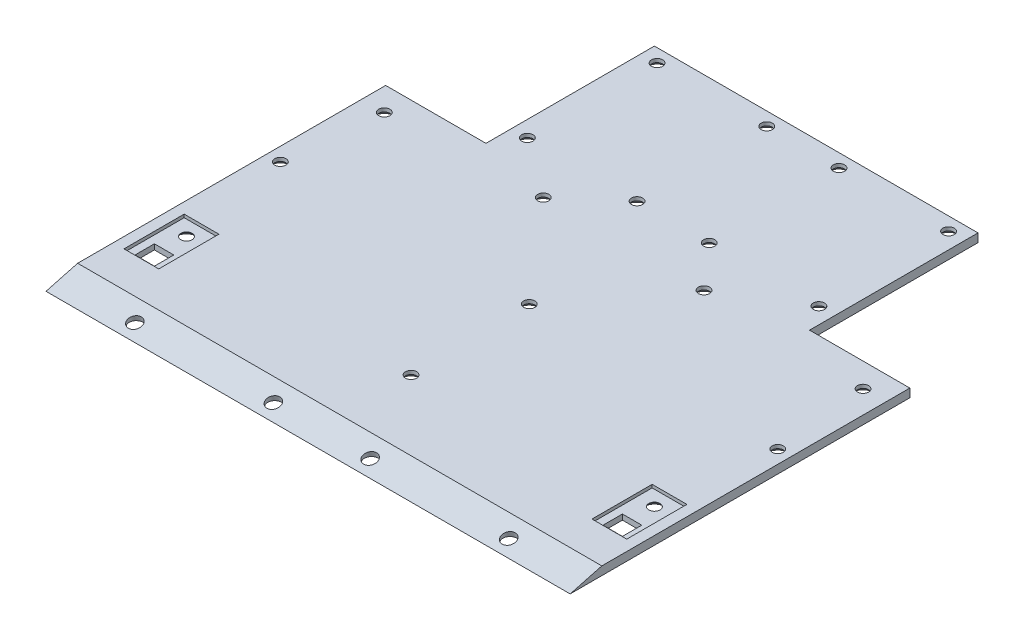
from build123d import *

# Parameters (mm, degrees)
SALIENTE_EXTRUIR1_DEPTH                              = 196
CORTAR_EXTRUIR1_REACH                                = 274.995
CROQUIS2_W                                           = 37.5
CROQUIS2_H                                           = 62.989872981
CROQUIS3_W                                           = 13
CROQUIS3_H                                           = 22.5
CORTAR_EXTRUIR2_DEPTH                                = 1.17
CORTAR_EXTRUIR3_REACH                                = 274.984
CROQUIS5_W                                           = 7.25
CROQUIS5_H                                           = 7.25
CORTAR_EXTRUIR4_REACH                                = 274.984
CROQUIS6_R                                           = 1.6
CUT_EXTRUDE1_REACH                                   = 274.995
SKETCH1_R                                            = 1.585
CUT_EXTRUDE2_REACH                                   = 274.995
SKETCH2_R                                            = 1.585
CUT_EXTRUDE3_REACH                                   = 274.995
SKETCH3_R                                            = 1.579889923
SKETCH3_R_2                                          = 1.585
SKETCH4_R                                            = 1.6
CUT_EXTRUDE4_DEPTH                                   = 4.9
AVELLANADO_PARA_TORNILLO_CON_CABEZA_AVEL_D           = 4.2
AVELLANADO_PARA_TORNILLO_CON_CABEZA_AVEL_DEPTH       = 10
AVELLANADO_PARA_TORNILLO_CON_CABEZA_AVEL_CSINK_D     = 8
AVELLANADO_PARA_TORNILLO_CON_CABEZA_AVEL_CSINK_ANGLE = 92
AVELLANADO_PARA_TORNILLO_CON_CABEZA_AVEL_TIP         = 1.2618073
SKETCH6_R                                            = 1.585
CUT_EXTRUDE5_DEPTH                                   = 10
SKETCH8_R                                            = 2.5
CUT_EXTRUDE6_DEPTH                                   = 10
AVELLANADO_PARA_TORNILLO_CON_CABEZA_2_D              = 4.2
AVELLANADO_PARA_TORNILLO_CON_CABEZA_2_DEPTH          = 10
AVELLANADO_PARA_TORNILLO_CON_CABEZA_2_CSINK_D        = 8
AVELLANADO_PARA_TORNILLO_CON_CABEZA_2_CSINK_ANGLE    = 92
AVELLANADO_PARA_TORNILLO_CON_CABEZA_2_TIP            = 1.2618073


with BuildPart() as part:
    # Croquis1 → Saliente-Extruir1 (new body)
    with BuildSketch(Plane(origin=(0, 0, 0), x_dir=(0, 0, -1), z_dir=(1, 0, 0))):
        Polygon((0, 0), (190, 0), (190, 3.17), (11.83060106, 3.17), align=None)
    extrude(amount=SALIENTE_EXTRUIR1_DEPTH)

    # Croquis2 → Cortar-Extruir1 (cut, up to next)
    with BuildSketch(Plane(origin=(0, 0, 0), x_dir=(-1, 0, 0), z_dir=(0, -1, 0)), mode=Mode.PRIVATE) as cortar_extruir1_sk1:
        with Locations((-18.75, 158.50506351)):
            Rectangle(CROQUIS2_W, CROQUIS2_H)
    cortar_extruir1_tool1 = extrude(cortar_extruir1_sk1.sketch, amount=-CORTAR_EXTRUIR1_REACH, mode=Mode.PRIVATE) & part.part
    cortar_extruir1 = cortar_extruir1_tool1.solids().sort_by_distance((18.75, 0, -158.505064))[0]
    add(cortar_extruir1, mode=Mode.SUBTRACT)

    # Simetría1: Cortar-Extruir1 across plane
    add(cortar_extruir1.mirror(Plane.ZY.offset(-98)), mode=Mode.SUBTRACT)

    # Croquis3 → Cortar-Extruir2 (cut)
    with BuildSketch(Plane(origin=(0, 3.17, 0), x_dir=(1, 0, 0), z_dir=(0, 1, 0))):
        with Locations((10.5, 36.41)):
            Rectangle(CROQUIS3_W, CROQUIS3_H)
    cortar_extruir2 = extrude(amount=-CORTAR_EXTRUIR2_DEPTH, mode=Mode.SUBTRACT)

    # Croquis5 → Cortar-Extruir3 (cut, up to next)
    with BuildSketch(Plane(origin=(0, 2, 0), x_dir=(1, 0, 0), z_dir=(0, 1, 0)), mode=Mode.PRIVATE) as cortar_extruir3_sk1:
        with Locations((10.5, 30.035)):
            Rectangle(CROQUIS5_W, CROQUIS5_H)
    cortar_extruir3_tool1 = extrude(cortar_extruir3_sk1.sketch, amount=-CORTAR_EXTRUIR3_REACH, mode=Mode.PRIVATE) & part.part
    cortar_extruir3 = cortar_extruir3_tool1.solids().sort_by_distance((10.5, 2, -30.035))[0]
    add(cortar_extruir3, mode=Mode.SUBTRACT)

    # Croquis6 → Cortar-Extruir4 (cut, up to next)
    with BuildSketch(Plane(origin=(0, 2, 0), x_dir=(1, 0, 0), z_dir=(0, 1, 0)), mode=Mode.PRIVATE) as cortar_extruir4_sk1:
        with Locations((10.5, 42.01)):
            Circle(CROQUIS6_R)
    cortar_extruir4_tool1 = extrude(cortar_extruir4_sk1.sketch, amount=-CORTAR_EXTRUIR4_REACH, mode=Mode.PRIVATE) & part.part
    cortar_extruir4 = cortar_extruir4_tool1.solids().sort_by_distance((10.5, 2, -42.01))[0]
    add(cortar_extruir4, mode=Mode.SUBTRACT)

    # Simetría2: Cortar-Extruir2, Cortar-Extruir3, Cortar-Extruir4 across plane
    add(cortar_extruir2.mirror(Plane.ZY.offset(-98)), mode=Mode.SUBTRACT)
    add(cortar_extruir3.mirror(Plane.ZY.offset(-98)), mode=Mode.SUBTRACT)
    add(cortar_extruir4.mirror(Plane.ZY.offset(-98)), mode=Mode.SUBTRACT)

    # Sketch1 → Cut-Extrude1 (cut, up to next)
    with BuildSketch(Plane(origin=(0, 3.17, 0), x_dir=(1, 0, 0), z_dir=(0, 1, 0)), mode=Mode.PRIVATE) as cut_extrude1_sk1:
        with Locations((8.5, 118.010127019)):
            Circle(SKETCH1_R)
    cut_extrude1_tool1 = extrude(cut_extrude1_sk1.sketch, amount=-CUT_EXTRUDE1_REACH, mode=Mode.PRIVATE) & part.part
    # Sketch1 → Cut-Extrude1 (cut, up to next)
    with BuildSketch(Plane(origin=(0, 3.17, 0), x_dir=(1, 0, 0), z_dir=(0, 1, 0)), mode=Mode.PRIVATE) as cut_extrude1_sk2:
        with Locations((187.5, 118.010127019)):
            Circle(SKETCH1_R)
    cut_extrude1_tool2 = extrude(cut_extrude1_sk2.sketch, amount=-CUT_EXTRUDE1_REACH, mode=Mode.PRIVATE) & part.part
    add(cut_extrude1_tool1.solids().sort_by_distance((8.5, 3.17, -118.010127))[0], mode=Mode.SUBTRACT)
    add(cut_extrude1_tool2.solids().sort_by_distance((187.5, 3.17, -118.010127))[0], mode=Mode.SUBTRACT)

    # Sketch2 → Cut-Extrude2 (cut, up to next)
    with BuildSketch(Plane(origin=(0, 3.17, 0), x_dir=(1, 0, 0), z_dir=(0, 1, 0)), mode=Mode.PRIVATE) as cut_extrude2_sk1:
        with Locations((98.5, 38.010127019)):
            Circle(SKETCH2_R)
    cut_extrude2_tool1 = extrude(cut_extrude2_sk1.sketch, amount=-CUT_EXTRUDE2_REACH, mode=Mode.PRIVATE) & part.part
    add(cut_extrude2_tool1.solids().sort_by_distance((98.5, 3.17, -38.010127))[0], mode=Mode.SUBTRACT)

    # Sketch3 → Cut-Extrude3 (cut, up to next)
    with BuildSketch(Plane(origin=(0, 3.17, 0), x_dir=(1, 0, 0), z_dir=(0, 1, 0)), mode=Mode.PRIVATE) as cut_extrude3_sk1:
        with Locations((43.5, 185)):
            Circle(SKETCH3_R)
    cut_extrude3_tool1 = extrude(cut_extrude3_sk1.sketch, amount=-CUT_EXTRUDE3_REACH, mode=Mode.PRIVATE) & part.part
    # Sketch3 → Cut-Extrude3 (cut, up to next)
    with BuildSketch(Plane(origin=(0, 3.17, 0), x_dir=(1, 0, 0), z_dir=(0, 1, 0)), mode=Mode.PRIVATE) as cut_extrude3_sk2:
        with Locations((84.5, 185)):
            Circle(SKETCH3_R_2)
    cut_extrude3_tool2 = extrude(cut_extrude3_sk2.sketch, amount=-CUT_EXTRUDE3_REACH, mode=Mode.PRIVATE) & part.part
    # Sketch3 → Cut-Extrude3 (cut, up to next)
    with BuildSketch(Plane(origin=(0, 3.17, 0), x_dir=(1, 0, 0), z_dir=(0, 1, 0)), mode=Mode.PRIVATE) as cut_extrude3_sk3:
        with Locations((152.5, 185)):
            Circle(SKETCH3_R_2)
    cut_extrude3_tool3 = extrude(cut_extrude3_sk3.sketch, amount=-CUT_EXTRUDE3_REACH, mode=Mode.PRIVATE) & part.part
    # Sketch3 → Cut-Extrude3 (cut, up to next)
    with BuildSketch(Plane(origin=(0, 3.17, 0), x_dir=(1, 0, 0), z_dir=(0, 1, 0)), mode=Mode.PRIVATE) as cut_extrude3_sk4:
        with Locations((111.5, 185)):
            Circle(SKETCH3_R_2)
    cut_extrude3_tool4 = extrude(cut_extrude3_sk4.sketch, amount=-CUT_EXTRUDE3_REACH, mode=Mode.PRIVATE) & part.part
    # Sketch3 → Cut-Extrude3 (cut, up to next)
    with BuildSketch(Plane(origin=(0, 3.17, 0), x_dir=(1, 0, 0), z_dir=(0, 1, 0)), mode=Mode.PRIVATE) as cut_extrude3_sk5:
        with Locations((111.5, 136.5)):
            Circle(SKETCH3_R_2)
    cut_extrude3_tool5 = extrude(cut_extrude3_sk5.sketch, amount=-CUT_EXTRUDE3_REACH, mode=Mode.PRIVATE) & part.part
    # Sketch3 → Cut-Extrude3 (cut, up to next)
    with BuildSketch(Plane(origin=(0, 3.17, 0), x_dir=(1, 0, 0), z_dir=(0, 1, 0)), mode=Mode.PRIVATE) as cut_extrude3_sk6:
        with Locations((152.5, 136.5)):
            Circle(SKETCH3_R_2)
    cut_extrude3_tool6 = extrude(cut_extrude3_sk6.sketch, amount=-CUT_EXTRUDE3_REACH, mode=Mode.PRIVATE) & part.part
    # Sketch3 → Cut-Extrude3 (cut, up to next)
    with BuildSketch(Plane(origin=(0, 3.17, 0), x_dir=(1, 0, 0), z_dir=(0, 1, 0)), mode=Mode.PRIVATE) as cut_extrude3_sk7:
        with Locations((84.5, 136.5)):
            Circle(SKETCH3_R_2)
    cut_extrude3_tool7 = extrude(cut_extrude3_sk7.sketch, amount=-CUT_EXTRUDE3_REACH, mode=Mode.PRIVATE) & part.part
    # Sketch3 → Cut-Extrude3 (cut, up to next)
    with BuildSketch(Plane(origin=(0, 3.17, 0), x_dir=(1, 0, 0), z_dir=(0, 1, 0)), mode=Mode.PRIVATE) as cut_extrude3_sk8:
        with Locations((43.5, 136.5)):
            Circle(SKETCH3_R_2)
    cut_extrude3_tool8 = extrude(cut_extrude3_sk8.sketch, amount=-CUT_EXTRUDE3_REACH, mode=Mode.PRIVATE) & part.part
    add(cut_extrude3_tool1.solids().sort_by_distance((43.5, 3.17, -185))[0], mode=Mode.SUBTRACT)
    add(cut_extrude3_tool2.solids().sort_by_distance((84.5, 3.17, -185))[0], mode=Mode.SUBTRACT)
    add(cut_extrude3_tool3.solids().sort_by_distance((152.5, 3.17, -185))[0], mode=Mode.SUBTRACT)
    add(cut_extrude3_tool4.solids().sort_by_distance((111.5, 3.17, -185))[0], mode=Mode.SUBTRACT)
    add(cut_extrude3_tool5.solids().sort_by_distance((111.5, 3.17, -136.5))[0], mode=Mode.SUBTRACT)
    add(cut_extrude3_tool6.solids().sort_by_distance((152.5, 3.17, -136.5))[0], mode=Mode.SUBTRACT)
    add(cut_extrude3_tool7.solids().sort_by_distance((84.5, 3.17, -136.5))[0], mode=Mode.SUBTRACT)
    add(cut_extrude3_tool8.solids().sort_by_distance((43.5, 3.17, -136.5))[0], mode=Mode.SUBTRACT)

    # Sketch4 → Cut-Extrude4 (cut)
    with BuildSketch(Plane(origin=(0, 3.17, 0), x_dir=(1, 0, 0), z_dir=(0, 1, 0))):
        with Locations((65.776416732, 120.166862559)):
            Circle(SKETCH4_R)
        with Locations((125.876416732, 120.166862559)):
            Circle(SKETCH4_R)
    extrude(amount=-CUT_EXTRUDE4_DEPTH, mode=Mode.SUBTRACT)

    # Avellanado para tornillo con cabeza avel
    with Locations(Plane(origin=(187.5, 0, -118.010127019), x_dir=(0, 0, -1), z_dir=(0, -1, 0))):
        with Locations((0, 0), (18.489872981, -35), (2.15673554, -61.623583268), (18.489872981, -76), (18.489872981, -103), (2.15673554, -121.723583268), (18.489872981, -144), (0, -179), (66.989872981, -144), (66.989872981, -103), (66.989872981, -76), (66.989872981, -35), (-76.000127019, -177), (-80, -89), (-76.000127019, -2)):
            CounterSinkHole(AVELLANADO_PARA_TORNILLO_CON_CABEZA_AVEL_D / 2, AVELLANADO_PARA_TORNILLO_CON_CABEZA_AVEL_CSINK_D / 2, depth=AVELLANADO_PARA_TORNILLO_CON_CABEZA_AVEL_DEPTH, counter_sink_angle=AVELLANADO_PARA_TORNILLO_CON_CABEZA_AVEL_CSINK_ANGLE)
            with Locations((0, 0, -(AVELLANADO_PARA_TORNILLO_CON_CABEZA_AVEL_DEPTH + AVELLANADO_PARA_TORNILLO_CON_CABEZA_AVEL_TIP / 2))):  # 118° drill point
                Cone(0, AVELLANADO_PARA_TORNILLO_CON_CABEZA_AVEL_D / 2, AVELLANADO_PARA_TORNILLO_CON_CABEZA_AVEL_TIP, mode=Mode.SUBTRACT)

    # Sketch6 → Cut-Extrude5 (cut)
    with BuildSketch(Plane(origin=(0, 3.17, 0), x_dir=(1, 0, 0), z_dir=(0, 1, 0))):
        with Locations((191.067111952, 82.557811806)):
            Circle(SKETCH6_R)
        with Locations((97.681935477, 83.038529763)):
            Circle(SKETCH6_R)
        with Locations((5.067111952, 82.557811806)):
            Circle(SKETCH6_R)
    extrude(amount=-CUT_EXTRUDE5_DEPTH, mode=Mode.SUBTRACT)

    # Sketch8 → Cut-Extrude6 (cut)
    with BuildSketch(Plane(origin=(0, 0, 0), x_dir=(1, 0, 0), z_dir=(0, 0.9659258262890681, 0.2588190451025218))):
        with Locations((28.1, 5.300133035)):
            Circle(SKETCH8_R)
        with Locations((79.9, 5.300133035)):
            Circle(SKETCH8_R)
        with Locations((116.1, 5.300133035)):
            Circle(SKETCH8_R)
        with Locations((167.9, 5.300133035)):
            Circle(SKETCH8_R)
    extrude(amount=-CUT_EXTRUDE6_DEPTH, mode=Mode.SUBTRACT)

    # Avellanado para tornillo con cabeza  2
    with Locations(Plane(origin=(97.681935477, 0, -83.038529763), x_dir=(0, 0, -1), z_dir=(0, -1, 0))):
        with Locations((0, 0), (-0.480717957, -92.614823525), (-0.480717957, 93.385176475)):
            CounterSinkHole(AVELLANADO_PARA_TORNILLO_CON_CABEZA_2_D / 2, AVELLANADO_PARA_TORNILLO_CON_CABEZA_2_CSINK_D / 2, depth=AVELLANADO_PARA_TORNILLO_CON_CABEZA_2_DEPTH, counter_sink_angle=AVELLANADO_PARA_TORNILLO_CON_CABEZA_2_CSINK_ANGLE)
            with Locations((0, 0, -(AVELLANADO_PARA_TORNILLO_CON_CABEZA_2_DEPTH + AVELLANADO_PARA_TORNILLO_CON_CABEZA_2_TIP / 2))):  # 118° drill point
                Cone(0, AVELLANADO_PARA_TORNILLO_CON_CABEZA_2_D / 2, AVELLANADO_PARA_TORNILLO_CON_CABEZA_2_TIP, mode=Mode.SUBTRACT)


solid = part.part
